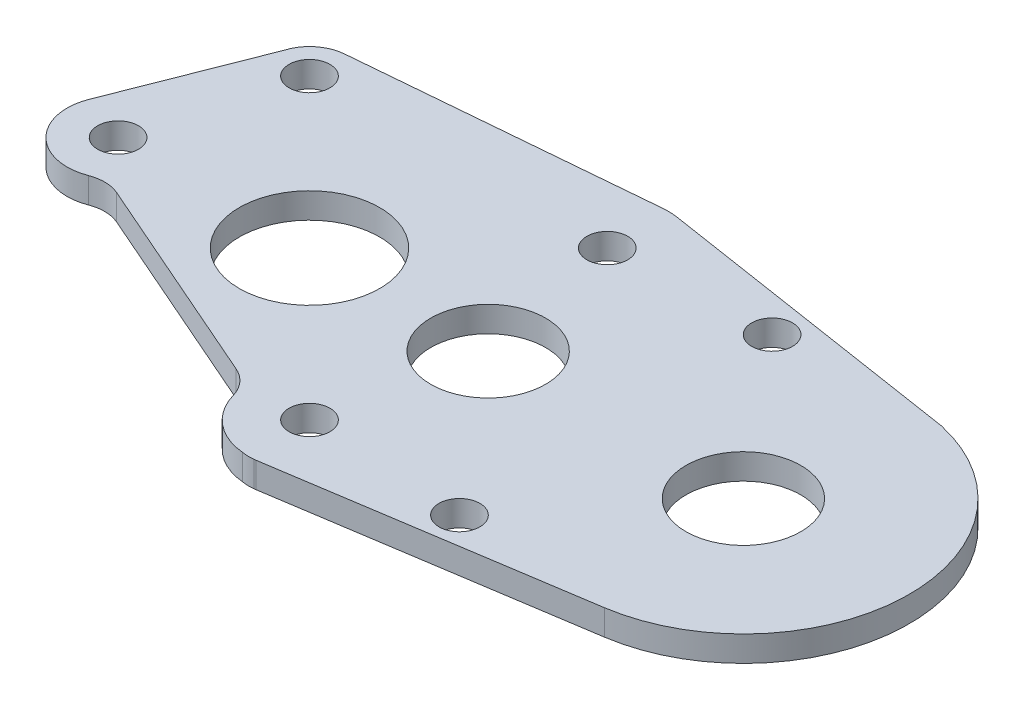
from build123d import *

# Parameters (mm, degrees)
SKETCH1_R           = 1.6
SKETCH1_R_2         = 1
SKETCH1_R_3         = 5.5
SKETCH1_R_4         = 4.5
BOSS_EXTRUDE2_DEPTH = 2
BOSS_EXTRUDE3_START = -2
SKETCH2_R           = 1
BOSS_EXTRUDE3_DEPTH = 2
SKETCH3_R           = 1
CUT_EXTRUDE1_DEPTH  = 103
BOSS_EXTRUDE4_START = -2
SKETCH4_R           = 1.6
BOSS_EXTRUDE4_DEPTH = 2
SKETCH5_R           = 1.6
CUT_EXTRUDE2_DEPTH  = 10
SKETCH6_R           = 1.6
CUT_EXTRUDE3_DEPTH  = 10
BOSS_EXTRUDE5_DEPTH = 2
CUT_EXTRUDE4_DEPTH  = 10
SKETCH10_R          = 1.6
SKETCH10_R_2        = 5.5
SKETCH10_R_3        = 4.5
BOSS_EXTRUDE6_DEPTH = 2
FILLET2_START       = -1
FILLET2_DEPTH       = 4
FILLET2_2_DEPTH     = 2


with BuildPart() as part:
    # Sketch1 → Boss-Extrude2 (new body)
    with BuildSketch(Plane(origin=(0, 0, 0), x_dir=(1, 0, 0), z_dir=(0, 1, 0))):
        with BuildLine():
            Line((12.313589515, -16.493996637), (35.979225245, -12.848450001))
            ThreePointArc((35.979225245, -12.848450001), (46.993067566, -0.424494085), (36.813648041, 12.691862933))
            Line((36.813648041, 12.691862933), (35.165189196, 12.947676785))
            Line((35.165189196, 12.947676785), (12.319067304, 16.493021261))
            ThreePointArc((12.319067304, 16.493021261), (11.720527595, 16.549330191), (11.119556233, 16.533395936))
            Line((11.119556233, 16.533395936), (-11.812019178, 14.541098507))
            ThreePointArc((-11.812019178, 14.541098507), (-13.247239988, 14.027709898), (-14.244912332, 12.87528787))
            Line((-14.244912332, 12.87528787), (-19.487592157, 2.204884721))
            ThreePointArc((-19.487592157, 2.204884721), (-19.693653105, -1.723258696), (-16.994761113, -4.584858569))
            Line((-16.994761113, -4.584858569), (9.557587922, -16.137143667))
            ThreePointArc((9.557587922, -16.137143667), (10.910298182, -16.51089082), (12.313589515, -16.493996637))
        make_face()
        with Locations(Location((11.552349036, -11.552285098, 0), (0, 0, 270))):
            Circle(SKETCH1_R, mode=Mode.SUBTRACT)
        with Locations(Location((25, -11, 0), (0, 0, 270))):
            Circle(SKETCH1_R_2, mode=Mode.SUBTRACT)
        with Locations(Location((-15, 0, 0), (0, 0, 270))):
            Circle(SKETCH1_R, mode=Mode.SUBTRACT)
        with Locations(Location((0, 0, 0), (0, 0, 270))):
            Circle(SKETCH1_R_3, mode=Mode.SUBTRACT)
        with Locations(Location((-11.552357038, 11.552357038, 0), (0, 0, 270))):
            Circle(SKETCH1_R, mode=Mode.SUBTRACT)
        with Locations(Location((11.552326466, 11.552160153, 0), (0, 0, 270))):
            Circle(SKETCH1_R, mode=Mode.SUBTRACT)
        with Locations(Location((14, 0, 0), (0, 0, 270))):
            Circle(SKETCH1_R_4, mode=Mode.SUBTRACT)
        with Locations(Location((34, 0, 0), (0, 0, 270))):
            Circle(SKETCH1_R_4, mode=Mode.SUBTRACT)
        with Locations(Location((25, 11, 0), (0, 0, 270))):
            Circle(SKETCH1_R_2, mode=Mode.SUBTRACT)
    extrude(amount=BOSS_EXTRUDE2_DEPTH)

    # Sketch2 → Boss-Extrude3 (add)
    with BuildSketch(Plane(origin=(0, 2, 0), x_dir=(1, 0, 0), z_dir=(0, 1, 0)).offset(BOSS_EXTRUDE3_START)):
        with Locations((25, 11)):
            Circle(SKETCH2_R)
        with Locations((25, -11)):
            Circle(SKETCH2_R)
    extrude(amount=BOSS_EXTRUDE3_DEPTH)

    # Sketch3 → Cut-Extrude1 (cut)
    with BuildSketch(Plane(origin=(0, 2, 0), x_dir=(1, 0, 0), z_dir=(0, 1, 0))):
        with Locations(Location((24, 13, 0), (0, 0, 270))):
            Circle(SKETCH3_R)
        with Locations(Location((24, -13, 0), (0, 0, 270))):
            Circle(SKETCH3_R)
    extrude(amount=-CUT_EXTRUDE1_DEPTH, mode=Mode.SUBTRACT)

    # Sketch4 → Boss-Extrude4 (add)
    with BuildSketch(Plane(origin=(0, 2, 0), x_dir=(1, 0, 0), z_dir=(0, 1, 0)).offset(BOSS_EXTRUDE4_START)):
        with Locations((-11.552357038, 11.552357038)):
            Circle(SKETCH4_R)
        with Locations((11.552326466, 11.552160153)):
            Circle(SKETCH4_R)
        with Locations((11.552349036, -11.552285098)):
            Circle(SKETCH4_R)
    extrude(amount=BOSS_EXTRUDE4_DEPTH)

    # Sketch5 → Cut-Extrude2 (cut)
    with BuildSketch(Plane(origin=(0, 2, 0), x_dir=(1, 0, 0), z_dir=(0, 1, 0))):
        with Locations(Location((-11.66726189, 11.66726189, 0), (0, 0, 270))):
            Circle(SKETCH5_R)
        with Locations(Location((11.66726189, 11.66726189, 0), (0, 0, 270))):
            Circle(SKETCH5_R)
        with Locations(Location((11.66726189, -11.66726189, 0), (0, 0, 270))):
            Circle(SKETCH5_R)
    extrude(amount=-CUT_EXTRUDE2_DEPTH, mode=Mode.SUBTRACT)

    # Sketch6 → Cut-Extrude3 (cut)
    with BuildSketch(Plane(origin=(0, 2, 0), x_dir=(1, 0, 0), z_dir=(0, 1, 0))):
        with Locations((24, 12.25)):
            Circle(SKETCH6_R)
        with Locations((24, -12.25)):
            Circle(SKETCH6_R)
    extrude(amount=-CUT_EXTRUDE3_DEPTH, mode=Mode.SUBTRACT)

    # Sketch7 → Boss-Extrude5 (add)
    with BuildSketch(Plane(origin=(0, 2, 0), x_dir=(1, 0, 0), z_dir=(0, 1, 0))):
        with BuildLine():
            ThreePointArc((24.746843357, 13.665), (24, 14), (23.253156643, 13.665))
            ThreePointArc((23.253156643, 13.665), (24, 13.85), (24.746843357, 13.665))
        make_face()
        with BuildLine():
            ThreePointArc((23.253156643, -13.665), (24, -13.85), (24.746843357, -13.665))
            ThreePointArc((24.746843357, -13.665), (24, -14), (23.253156643, -13.665))
        make_face()
    extrude(amount=-BOSS_EXTRUDE5_DEPTH)

    # Sketch8 → Cut-Extrude4 (cut)
    with BuildSketch(Plane(origin=(0, 2, 0), x_dir=(1, 0, 0), z_dir=(0, 1, 0))):
        with BuildLine():
            Line((-14.308416207, 12.704426351), (-18.723213135, 1.462082061))
            ThreePointArc((-18.723213135, 1.462082061), (-16.986293656, -3.471978904), (-11.852582747, -2.468555172))
            Line((-11.852582747, -2.468555172), (6.930322315, -10.68631196))
            ThreePointArc((6.930322315, -10.68631196), (7.786759617, -14.555611143), (11.247508844, -16.486459611))
            Line((11.247508844, -16.486459611), (11.232461738, -16.659215907))
            Line((11.232461738, -16.659215907), (-9.768707716, -29.444072038))
            Line((-9.768707716, -29.444072038), (-31.03313029, 2.888905984))
            Line((-31.03313029, 2.888905984), (-14.308416207, 12.704426351))
        make_face()
    extrude(amount=-CUT_EXTRUDE4_DEPTH, mode=Mode.SUBTRACT)

    # Sketch10 → Boss-Extrude6 (add)
    # profile 1 of 3: a face of its own
    with BuildSketch(Plane(origin=(0, 2, 0), x_dir=(1, 0, 0), z_dir=(0, 1, 0))):
        with BuildLine():
            Line((6.930322315, -10.68631196), (-2.461130216, -6.577433566))
            Line((-2.461130216, -6.577433566), (-2.861958704, -7.493586677))
            Line((-2.861958704, -7.493586677), (6.830279674, -11.734062656))
            ThreePointArc((6.830279674, -11.734062656), (6.851720384, -11.207458338), (6.930322315, -10.68631196))
        make_face()
    # profile 2 of 3: a face of its own
    with BuildSketch(Plane(origin=(0, 2, 0), x_dir=(1, 0, 0), z_dir=(0, 1, 0))):
        with BuildLine():
            Line((-2.861958704, -7.493586677), (-2.461130216, -6.577433566))
            Line((-2.461130216, -6.577433566), (-11.852582747, -2.468555172))
            ThreePointArc((-11.852582747, -2.468555172), (-12.214781898, -2.870985915), (-12.628009506, -3.220816837))
            Line((-12.628009506, -3.220816837), (-2.861958704, -7.493586677))
        make_face()
    # profile 3 of 3: a face of its own
    with BuildSketch(Plane(origin=(0, 2, 0), x_dir=(1, 0, 0), z_dir=(0, 1, 0))):
        with BuildLine():
            Line((8.035421862, -12.261327493), (6.830279674, -11.734062656))
            ThreePointArc((6.830279674, -11.734062656), (8.124009767, -14.960622436), (11.247508844, -16.486459611))
            Line((11.247508844, -16.486459611), (11.242611849, -16.542682164))
            ThreePointArc((11.242611849, -16.542682164), (11.779409327, -16.5471268), (12.313589515, -16.493996637))
            Line((12.313589515, -16.493996637), (35.979225245, -12.848450001))
            ThreePointArc((35.979225245, -12.848450001), (46.993067566, -0.424494085), (36.813648041, 12.691862933))
            Line((36.813648041, 12.691862933), (12.319067304, 16.493021261))
            ThreePointArc((12.319067304, 16.493021261), (11.720527595, 16.549330191), (11.119556233, 16.533395936))
            Line((11.119556233, 16.533395936), (-11.812019178, 14.541098507))
            ThreePointArc((-11.812019178, 14.541098507), (-13.247239988, 14.027709898), (-14.244912332, 12.87528787))
            Line((-14.244912332, 12.87528787), (-14.337145922, 12.68756525))
            Line((-14.337145922, 12.68756525), (-14.308416207, 12.704426351))
            Line((-14.308416207, 12.704426351), (-18.723213135, 1.462082061))
            ThreePointArc((-18.723213135, 1.462082061), (-17.436972748, -3.171933767), (-12.628009506, -3.220816837))
            Line((-12.628009506, -3.220816837), (-13.301998386, -2.925938239))
            Line((-13.301998386, -2.925938239), (-11.820094843, -1.440006983))
            Line((-11.820094843, -1.440006983), (-1.105948659, -6.127580457))
            Line((-1.105948659, -6.127580457), (8.611687481, -8.831618339))
            Line((8.611687481, -8.831618339), (8.035421862, -12.261327493))
        make_face()
        with Locations(Location((11.66726189, -11.66726189, 0), (0, 0, 270))):
            Circle(SKETCH10_R, mode=Mode.SUBTRACT)
        with Locations(Location((24, -12.25, 0), (0, 0, 270))):
            Circle(SKETCH10_R, mode=Mode.SUBTRACT)
        with Locations(Location((-15, 0, 0), (0, 0, 270))):
            Circle(SKETCH10_R, mode=Mode.SUBTRACT)
        with Locations(Location((0, 0, 0), (0, 0, 270))):
            Circle(SKETCH10_R_2, mode=Mode.SUBTRACT)
        with Locations(Location((-11.66726189, 11.66726189, 0), (0, 0, 270))):
            Circle(SKETCH10_R, mode=Mode.SUBTRACT)
        with Locations(Location((11.66726189, 11.66726189, 0), (0, 0, 270))):
            Circle(SKETCH10_R, mode=Mode.SUBTRACT)
        with Locations(Location((14, 0, 0), (0, 0, 270))):
            Circle(SKETCH10_R_3, mode=Mode.SUBTRACT)
        with Locations(Location((34, 0, 0), (0, 0, 270))):
            Circle(SKETCH10_R_3, mode=Mode.SUBTRACT)
        with Locations(Location((24, 12.25, 0), (0, 0, 270))):
            Circle(SKETCH10_R, mode=Mode.SUBTRACT)
    extrude(amount=-BOSS_EXTRUDE6_DEPTH)

    # Fillet2: read off the stored shape, not the designer's step
    # Fillet2 outline → Fillet2 (cut)
    with BuildSketch(Plane(origin=(0, 0, 0), x_dir=(1, 0, 0), z_dir=(0, 1, 0)).offset(FILLET2_START)):
        with BuildLine():
            ThreePointArc((11.242611849, -16.542682164), (11.704154362, -16.549980081), (12.16440304, -16.514682694))
            ThreePointArc((12.16440304, -16.514682694), (11.70487082, -16.535823924), (11.247508844, -16.486459611))
            Line((11.247508844, -16.486459611), (11.242611849, -16.542682164))
        make_face()
    extrude(amount=FILLET2_DEPTH, mode=Mode.SUBTRACT)

    # Fillet2 2 outline → Fillet2 2 (add)
    with BuildSketch(Plane(origin=(0, 0, 0), x_dir=(1, 0, 0), z_dir=(0, 1, 0))):
        with BuildLine():
            ThreePointArc((-13.580529798, -3.739666341), (-12.441461916, -3.545340418), (-11.313441681, -3.795956765))
            Line((-11.313441681, -3.795956765), (-12.628009506, -3.220816837))
            ThreePointArc((-12.628009506, -3.220816837), (-13.086601256, -3.512677788), (-13.580529798, -3.739666341))
        make_face()
        with BuildLine():
            ThreePointArc((5.336294885, -11.080425553), (6.391396593, -11.853207748), (7.01744839, -13.001463417))
            ThreePointArc((7.01744839, -13.001463417), (6.88172123, -12.373986651), (6.830279674, -11.734062656))
            Line((6.830279674, -11.734062656), (5.336294885, -11.080425553))
        make_face()
    extrude(amount=FILLET2_2_DEPTH)


solid = part.part
